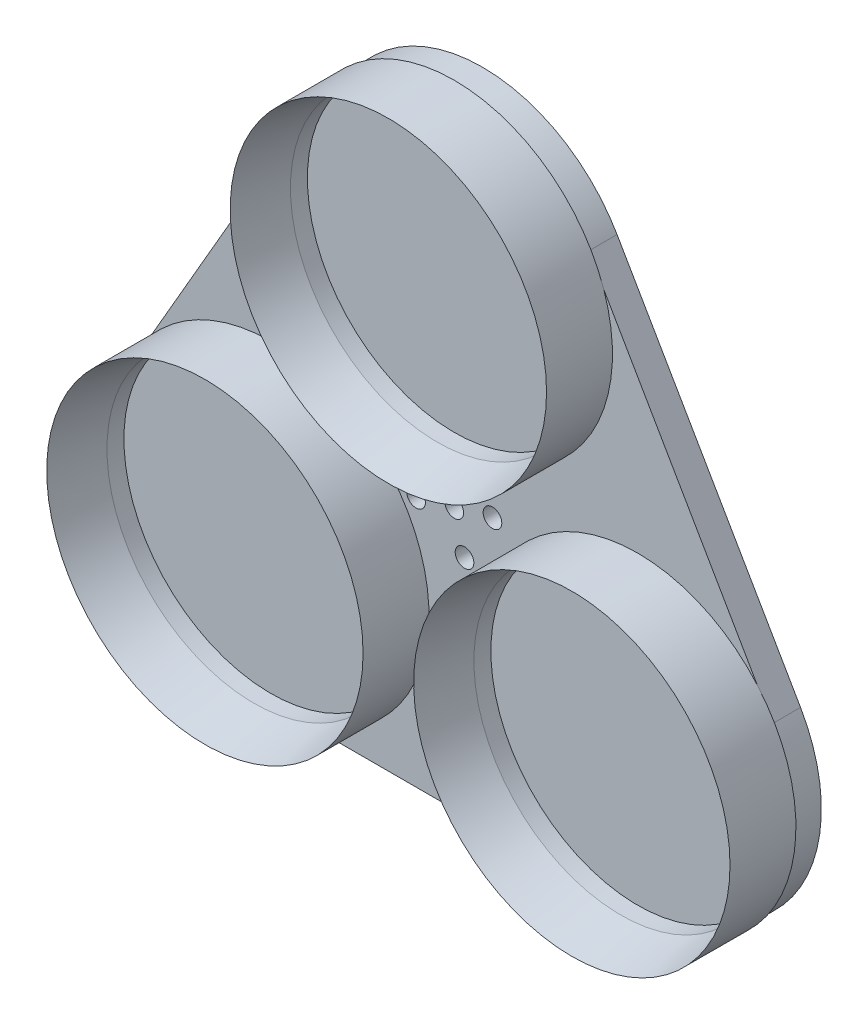
from build123d import *

# Parameters (mm, degrees)
EXTRUDE_1_DEPTH     = 5
SKETCH_2_R          = 28
SKETCH_2_R_2        = 26
EXTRUDE_2_DEPTH     = 16
SKETCH_3_R          = 1.65
CUT_EXTRUDE_1_DEPTH = 91.573676352
CHAMFER_1_SIZE      = 3
CHAMFER_1_SIZE_2    = 13


with BuildPart() as part:
    # 草图1 → 凸台-拉伸1 (new body)
    with BuildSketch(Plane.XY):
        with BuildLine():
            Line((-23.815698604, 51.25), (-56.291651246, -5))
            ThreePointArc((-56.291651246, -5), (-56.291651246, -32.5), (-32.475952642, -46.25))
            Line((-32.475952642, -46.25), (32.475952642, -46.25))
            ThreePointArc((32.475952642, -46.25), (56.291651246, -32.5), (56.291651246, -5))
            Line((56.291651246, -5), (23.815698604, 51.25))
            ThreePointArc((23.815698604, 51.25), (0, 65), (-23.815698604, 51.25))
        make_face()
    extrude(amount=EXTRUDE_1_DEPTH)

    # 草图2 → 凸台-拉伸2 (add)
    # profile 1 of 3: a face of its own
    with BuildSketch(Plane.XY.offset(5)):
        with Locations(Location((0, 37.5, 0), (0, 0, 160.844062564))):
            Circle(SKETCH_2_R)
        with Locations((0, 37.5)):
            Circle(SKETCH_2_R_2, mode=Mode.SUBTRACT)
    # profile 2 of 3: a face of its own
    with BuildSketch(Plane.XY.offset(5)):
        with Locations(Location((32.475952642, -18.75, 0), (0, 0, 259.155937436))):
            Circle(SKETCH_2_R)
        with Locations((32.475952642, -18.75)):
            Circle(SKETCH_2_R_2, mode=Mode.SUBTRACT)
    # profile 3 of 3: a face of its own
    with BuildSketch(Plane.XY.offset(5)):
        with Locations(Location((-32.475952642, -18.75, 0), (0, 0, 139.155937436))):
            Circle(SKETCH_2_R)
        with Locations((-32.475952642, -18.75)):
            Circle(SKETCH_2_R_2, mode=Mode.SUBTRACT)
    extrude(amount=EXTRUDE_2_DEPTH)

    # 草图3 → 切除-拉伸1 (cut, through all)
    with BuildSketch(Plane.XY.offset(5)):
        Circle(SKETCH_3_R)
        with Locations((-1.811733316, 6.761480784)):
            Circle(SKETCH_3_R)
        with Locations((6.761480784, 1.811733316)):
            Circle(SKETCH_3_R)
        with Locations((1.811733316, -6.761480784)):
            Circle(SKETCH_3_R)
        with Locations((-6.761480784, -1.811733316)):
            Circle(SKETCH_3_R)
    extrude(amount=-CUT_EXTRUDE_1_DEPTH, mode=Mode.SUBTRACT)

    # 倒角1
    # the kernel refuses this chamfer: 13, 3 mm, written as the material it takes off along each edge
    with BuildSketch(Plane(origin=(-32.475952642, -18.75, 21), x_dir=(1, 0, 0), z_dir=(0, -1, 0))) as chamfer_1_piece_1:
        Polygon((26 + CHAMFER_1_SIZE, 0), (26, -CHAMFER_1_SIZE_2), (26, 0), align=None)
    revolve(axis=Axis((-32.475952642, -18.75, 21), (0, 0, 1)), mode=Mode.SUBTRACT)
    with BuildSketch(Plane(origin=(32.475952642, -18.75, 21), x_dir=(1, 0, 0), z_dir=(0, -1, 0))) as chamfer_1_piece_2:
        Polygon((26 + CHAMFER_1_SIZE, 0), (26, -CHAMFER_1_SIZE_2), (26, 0), align=None)
    revolve(axis=Axis((32.475952642, -18.75, 21), (0, 0, 1)), mode=Mode.SUBTRACT)
    with BuildSketch(Plane(origin=(0, 37.5, 21), x_dir=(1, 0, 0), z_dir=(0, -1, 0))) as chamfer_1_piece_3:
        Polygon((26 + CHAMFER_1_SIZE, 0), (26, -CHAMFER_1_SIZE_2), (26, 0), align=None)
    revolve(axis=Axis((0, 37.5, 21), (0, 0, 1)), mode=Mode.SUBTRACT)


solid = part.part
